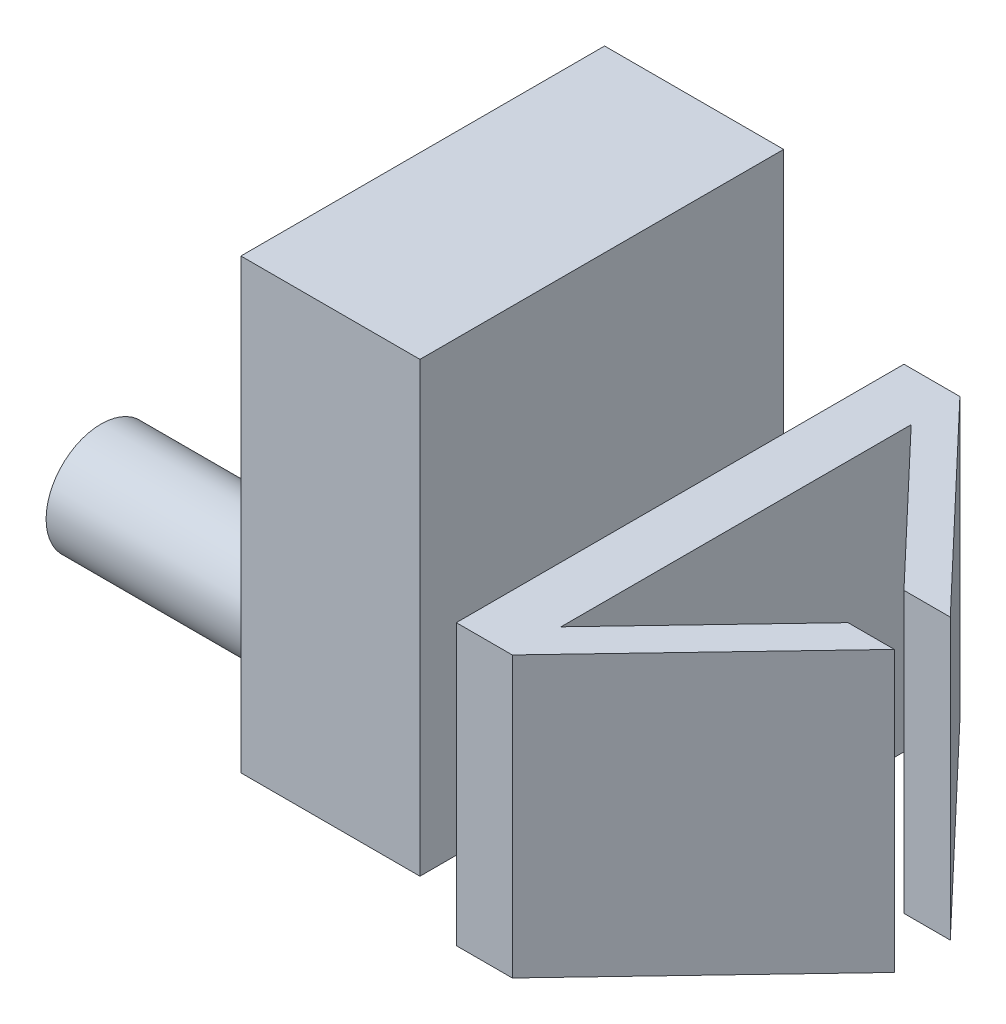
from build123d import *

# Parameters (mm, degrees)
SKETCH1_W           = 8.128
SKETCH1_H           = 16.51
BOSS_EXTRUDE1_DEPTH = 20.32
SKETCH2_R           = 2.493155922
BOSS_EXTRUDE2_DEPTH = 10.16
FILLET2_R           = 1.27
SKETCH3_W           = 8.89
SKETCH3_H           = 3.81
BOSS_EXTRUDE3_DEPTH = 3.556
FILLET3_R           = 1.27
BOSS_EXTRUDE4_DEPTH = 12.7
FILLET4_R           = 3.81


with BuildPart() as part:
    # Sketch1 → Boss-Extrude1 (new body)
    with BuildSketch(Plane(origin=(0, 0, 0), x_dir=(1, 0, 0), z_dir=(0, 1, 0))):
        Rectangle(SKETCH1_W, SKETCH1_H)
    extrude(amount=BOSS_EXTRUDE1_DEPTH)

    # Sketch2 → Boss-Extrude2 (add)
    with BuildSketch(Plane.ZY.offset(4.064)):
        with Locations(Location((4.445, 4.237080477, 0), (0, 0, 180))):
            Circle(SKETCH2_R)
    extrude(amount=BOSS_EXTRUDE2_DEPTH)

    # Fillet2
    fillet2_edges = [part.edges().sort_by_distance(p)[0] for p in [
        (-4.064, 4.237080477, 6.938155922),
    ]]
    fillet(fillet2_edges, radius=FILLET2_R)

    # Sketch3 → Boss-Extrude3 (add)
    with BuildSketch(Plane(origin=(4.064, 0, 0), x_dir=(0, 0, -1), z_dir=(1, 0, 0))):
        with Locations((0, 1.905)):
            Rectangle(SKETCH3_W, SKETCH3_H)
    extrude(amount=BOSS_EXTRUDE3_DEPTH)

    # Fillet3
    fillet3_edges = [part.edges().sort_by_distance(p)[0] for p in [
        (4.064, 3.81, 0),
    ]]
    fillet(fillet3_edges, radius=FILLET3_R)

    # Sketch5 → Boss-Extrude4 (add)
    with BuildSketch(Plane(origin=(0, 0, 0), x_dir=(-1, 0, 0), z_dir=(0, -1, 0))):
        Polygon((-10.16, -10.16), (-7.62, -10.16), (-7.62, 10.16), (-10.16, 10.16), (-18.612950502, 1.27), (-16.51, 1.27), (-10.16, 7.948319006), (-10.16, -7.948319006), (-16.51, -1.27), (-18.612950502, -1.27), align=None)
    extrude(amount=-BOSS_EXTRUDE4_DEPTH)

    # Fillet4
    # the kernel refuses this fillet: 3.81 mm, written as the material it adds along each edge
    with BuildSketch(Plane(origin=(7.62, 3.81, 4.445), x_dir=(0, 1, 0), z_dir=(0, 0, -1))) as fillet4_piece_1:
        with BuildLine():
            CenterArc((3.49192268, -3.81), FILLET4_R, 90, 66.421821522)
            Line((0, -2.286), (0, 0))
            Line((0, 0), (3.49192268, 0))
        make_face()
    extrude(amount=8.89)


solid = part.part
